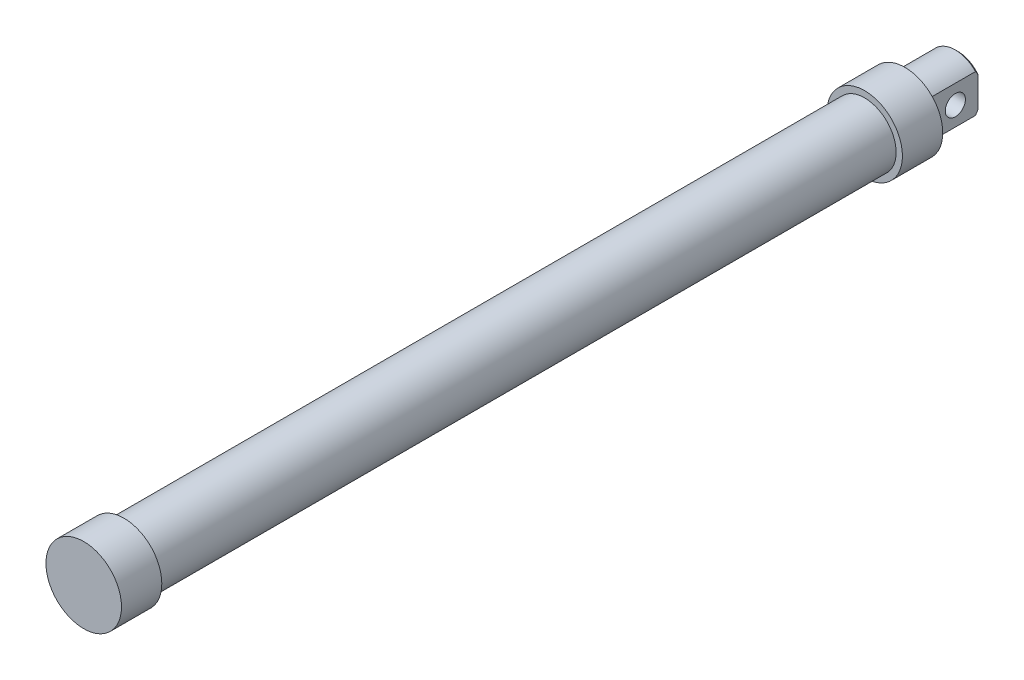
from build123d import *

# Parameters (mm, degrees)
ESQUISSE1_R             = 12.5
BOSS_EXTRU_1_DEPTH      = 326
ESQUISSE2_R             = 15
BOSS_EXTRU_2_DEPTH      = 16
BOSS_EXTRU_4_START      = -310
ESQUISSE2_2_R           = 15
BOSS_EXTRU_4_DEPTH      = 16
ESQUISSE3_R             = 11
BOSS_EXTRU_5_DEPTH      = 21
ESQUISSE4_W             = 5
ESQUISSE4_H             = 22
ENL_V_MAT_EXTRU_1_DEPTH = 19
CHANFREIN1_SIZE         = 1
ESQUISSE5_R             = 4
ENL_V_MAT_EXTRU_2_DEPTH = 328.1543978


with BuildPart() as part:
    # Esquisse1 → Boss.-Extru.1 (new body)
    with BuildSketch(Plane.XY):
        Circle(ESQUISSE1_R)
    extrude(amount=BOSS_EXTRU_1_DEPTH)

    # Esquisse2 → Boss.-Extru.2 (add)
    with BuildSketch(Plane.XY.offset(326)):
        Circle(ESQUISSE2_R)
    extrude(amount=-BOSS_EXTRU_2_DEPTH)

    # Esquisse2<2> → Boss.-Extru.4 (add)
    with BuildSketch(Plane.XY.offset(326).offset(BOSS_EXTRU_4_START)):
        Circle(ESQUISSE2_2_R)
    extrude(amount=-BOSS_EXTRU_4_DEPTH)

    # Esquisse3 → Boss.-Extru.5 (add)
    with BuildSketch(Plane(origin=(0, 0, 0), x_dir=(-1, 0, 0), z_dir=(0, 0, -1))):
        Circle(ESQUISSE3_R)
    extrude(amount=BOSS_EXTRU_5_DEPTH)

    # Esquisse4 → Enlèv. mat.-Extru.1 (cut)
    with BuildSketch(Plane(origin=(0, 0, -21), x_dir=(-1, 0, 0), z_dir=(0, 0, -1))):
        with Locations((-10.5, 0)):
            Rectangle(ESQUISSE4_W, ESQUISSE4_H)
        with Locations((10.5, 0)):
            Rectangle(ESQUISSE4_W, ESQUISSE4_H)
    extrude(amount=-ENL_V_MAT_EXTRU_1_DEPTH, mode=Mode.SUBTRACT)

    # Chanfrein1
    chanfrein1_edges = [part.edges().sort_by_distance(p)[0] for p in [
        (-8, 0, -2),
        (8, 0, -2),
        (0, -11, -21),
        (0, 11, -21),
    ]]
    chamfer(chanfrein1_edges, length=CHANFREIN1_SIZE)

    # Esquisse5 → Enlèv. mat.-Extru.2 (cut, through all)
    with BuildSketch(Plane(origin=(8, 0, 0), x_dir=(0, 0, -1), z_dir=(1, 0, 0))):
        with Locations((12, 0)):
            Circle(ESQUISSE5_R)
    extrude(amount=-ENL_V_MAT_EXTRU_2_DEPTH, mode=Mode.SUBTRACT)


solid = part.part
